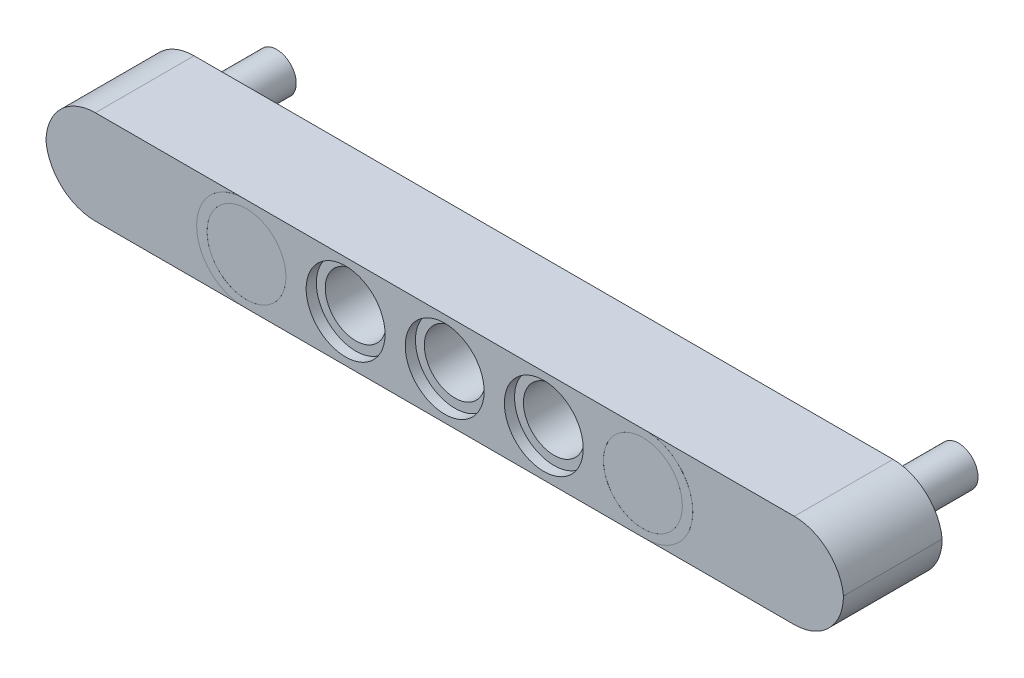
from build123d import *
from build123d.topology import SkipClean

# Parameters (mm, degrees)
SKETCH1_W                = 39
SKETCH1_H                = 7.38
BOSS_EXTRUDE1_DEPTH      = 7.76
SKETCH2_R                = 2.4
CUT_EXTRUDE1_DEPTH       = 7.76
CUT_EXTRUDE2_OUTLINE_R   = 3.1
CUT_EXTRUDE2_OUTLINE_R_2 = 2.4
CUT_EXTRUDE2_DEPTH       = 0.8
CUT_EXTRUDE3_START       = 6.96
CUT_EXTRUDE3_OUTLINE_R   = 3.1
CUT_EXTRUDE3_OUTLINE_R_2 = 2.4
CUT_EXTRUDE3_DEPTH       = 0.8
LPATTERN3_COUNT          = 3
LPATTERN3_PITCH          = 7.79
LPATTERN6_COUNT          = 3
LPATTERN6_PITCH          = 7.79
FILLET1_R                = 3.69
FILLET2_R                = 3.69
FILLET3_R                = 3.69
FILLET4_R                = 3.69
SCALE1_SCALE             = 1.03
SKETCH5_R                = 3.193
BOSS_EXTRUDE2_DEPTH      = 7.99
SKETCH7_W                = 16
SKETCH7_H                = 7.6014
BOSS_EXTRUDE4_DEPTH      = 7.99
SKETCH4_R                = 1.59
BOSS_EXTRUDE5_DEPTH      = 6
FILLET5_R                = 4
FILLET6_R                = 4
FILLET7_R                = 4
FILLET8_R                = 4


with BuildPart() as part:
    # Sketch1 → Boss-Extrude1 (new body)
    with BuildSketch(Plane.XY):
        with Locations((19.5, 3.69)):
            Rectangle(SKETCH1_W, SKETCH1_H)
    extrude(amount=BOSS_EXTRUDE1_DEPTH)

    # Sketch2 → Cut-Extrude1 (cut)
    with BuildSketch(Plane.XY.offset(7.76)):
        with Locations((19.5, 3.69)):
            Circle(SKETCH2_R)
    cut_extrude1 = extrude(amount=-CUT_EXTRUDE1_DEPTH, mode=Mode.SUBTRACT)

    # Cut-Extrude2: read off the stored shape, not the designer's step
    # Cut-Extrude2 outline → Cut-Extrude2 (cut)
    with BuildSketch(Plane.XY):
        with Locations((19.5, 3.69)):
            Circle(CUT_EXTRUDE2_OUTLINE_R)
        with Locations((19.5, 3.69)):
            Circle(CUT_EXTRUDE2_OUTLINE_R_2, mode=Mode.SUBTRACT)
    cut_extrude2 = extrude(amount=CUT_EXTRUDE2_DEPTH, mode=Mode.SUBTRACT)

    # Cut-Extrude3: read off the stored shape, not the designer's step
    # Cut-Extrude3 outline → Cut-Extrude3 (cut)
    with BuildSketch(Plane.XY.offset(CUT_EXTRUDE3_START)):
        with Locations((19.5, 3.69)):
            Circle(CUT_EXTRUDE3_OUTLINE_R)
        with Locations((19.5, 3.69)):
            Circle(CUT_EXTRUDE3_OUTLINE_R_2, mode=Mode.SUBTRACT)
    cut_extrude3 = extrude(amount=CUT_EXTRUDE3_DEPTH, mode=Mode.SUBTRACT)

    # LPattern3: Cut-Extrude1, Cut-Extrude2, Cut-Extrude3 ×3
    with Locations(*[(-i * LPATTERN3_PITCH, 0, 0) for i in range(1, LPATTERN3_COUNT)]):
        add(cut_extrude1, mode=Mode.SUBTRACT)
        add(cut_extrude2, mode=Mode.SUBTRACT)
        add(cut_extrude3, mode=Mode.SUBTRACT)

    # LPattern6: Cut-Extrude1, Cut-Extrude2, Cut-Extrude3 ×3
    with Locations(*[(i * LPATTERN6_PITCH, 0, 0) for i in range(1, LPATTERN6_COUNT)]):
        add(cut_extrude1, mode=Mode.SUBTRACT)
        add(cut_extrude2, mode=Mode.SUBTRACT)
        add(cut_extrude3, mode=Mode.SUBTRACT)

    # Fillet1
    fillet1_edges = [part.edges().sort_by_distance(p)[0] for p in [
        (0, 7.38, 3.88),
    ]]
    fillet(fillet1_edges, radius=FILLET1_R)

    # Fillet2
    fillet2_edges = [part.edges().sort_by_distance(p)[0] for p in [
        (0, 0, 3.88),
    ]]
    fillet(fillet2_edges, radius=FILLET2_R - 0.0001)  # a hair under: the kernel refuses the full size

    # Fillet3
    fillet3_edges = [part.edges().sort_by_distance(p)[0] for p in [
        (39, 7.38, 3.88),
    ]]
    fillet(fillet3_edges, radius=FILLET3_R)

    # Fillet4
    fillet4_edges = [part.edges().sort_by_distance(p)[0] for p in [
        (39, 0, 3.88),
    ]]
    fillet(fillet4_edges, radius=FILLET4_R - 0.0001)  # a hair under: the kernel refuses the full size


with BuildPart() as part_1:
    # Scale1: scaled about (19.5, 3.689995512, 3.88)
    add(part.part.scale(SCALE1_SCALE).moved(Location((-0.585, -0.110699865, -0.1164))))

    # Sketch5 → Boss-Extrude2 (add)
    with BuildSketch(Plane(origin=(0, 0, -0.1164), x_dir=(-1, 0, 0), z_dir=(0, 0, -1))):
        with Locations((-35.5474, 3.69)):
            Circle(SKETCH5_R)
        with Locations((-3.4526, 3.69)):
            Circle(SKETCH5_R)
    extrude(amount=-BOSS_EXTRUDE2_DEPTH)

    # Sketch7 → Boss-Extrude4 (add)
    with SkipClean():  # the faces are left unmerged after this step: merging them gives an invalid solid
        with BuildSketch(Plane(origin=(0, 0, -0.1164), x_dir=(-1, 0, 0), z_dir=(0, 0, -1))):
            with Locations((-43.7843, 3.69)):
                Rectangle(SKETCH7_W, SKETCH7_H)
            with Locations((4.7843, 3.69)):
                Rectangle(SKETCH7_W, SKETCH7_H)
        extrude(amount=-BOSS_EXTRUDE4_DEPTH)

    # Sketch4 → Boss-Extrude5 (add)
    with SkipClean():  # the faces are left unmerged after this step: merging them gives an invalid solid
        with BuildSketch(Plane(origin=(0, 0, -0.1164), x_dir=(-1, 0, 0), z_dir=(0, 0, -1))):
            with Locations((-47.1, 3.69)):
                Circle(SKETCH4_R)
            with Locations((8.1, 3.69)):
                Circle(SKETCH4_R)
        extrude(amount=BOSS_EXTRUDE5_DEPTH)

    # Fillet5
    fillet5_edges = [part_1.edges().sort_by_distance(p)[0] for p in [
        (51.7843, -0.1107, 3.8786),
    ]]
    fillet(fillet5_edges, radius=FILLET5_R)

    # Fillet6
    # the kernel refuses this fillet: 4 mm, written as the material it takes off along each edge
    with BuildSketch(Plane(origin=(51.7843, 7.4907, -10.066625513), x_dir=(0, -1, 0), z_dir=(0, 0, 1))) as fillet6_piece_1:
        with BuildLine():
            CenterArc((4, -3.980090205), FILLET6_R, 95.719016284, 84.280983716)
            Line((0, -3.980090205), (-0.08, -3.980090205))
            Line((-0.08, -3.980090205), (-0.08, 0))
            Line((-0.08, 0), (0, 0.08))
            ThreePointArc((0, 0.08), (1.8007, 0.08), (3.593428, 0.079601804))
            Line((3.593428, 0.079601804), (3.6014, 0))
        make_face()
    extrude(amount=27.890451025, mode=Mode.SUBTRACT)

    # Fillet7
    fillet7_edges = [part_1.edges().sort_by_distance(p)[0] for p in [
        (-12.7843, 7.4907, 3.8786),
    ]]
    fillet(fillet7_edges, radius=FILLET7_R)

    # Fillet8
    # the kernel refuses this fillet: 4 mm, written as the material it takes off along each edge
    with BuildSketch(Plane(origin=(-12.7843, -0.1107, -10.066625513), x_dir=(0, 1, 0), z_dir=(0, 0, 1))) as fillet8_piece_1:
        with BuildLine():
            CenterArc((4, -3.980090205), FILLET8_R, 95.719016284, 84.280983716)
            Line((0, -3.980090205), (-0.08, -3.980090205))
            Line((-0.08, -3.980090205), (-0.08, 0))
            Line((-0.08, 0), (0, 0.08))
            ThreePointArc((0, 0.08), (1.8007, 0.08), (3.593428, 0.079601804))
            Line((3.593428, 0.079601804), (3.6014, 0))
        make_face()
    extrude(amount=27.890451025, mode=Mode.SUBTRACT)


solid = part_1.part
